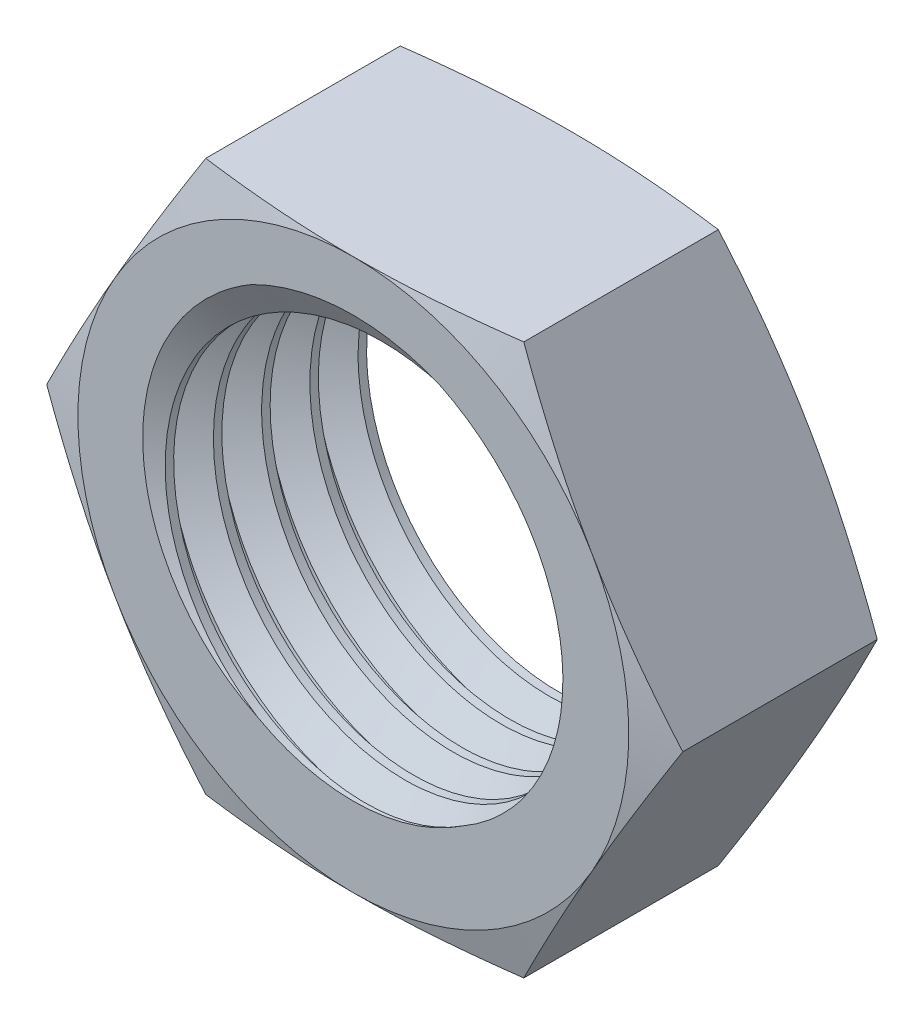
from build123d import *

# Parameters (mm, degrees)
BODY_DEPTH           = 8.2
SZKIC2_R             = 7.4
HOLE_DEPTH           = 8.2
SZKIC4_OUTSIDE_W     = 37.036
SZKIC4_OUTSIDE_H     = 33.82
SZKIC4_OUTSIDE_R     = 10.392304845
CHAMFERING_TOP_DEPTH = 0.6
CHAMFERING_TOP_DRAFT = -75
SZKIC3_OUTSIDE_W     = 37.036
SZKIC3_OUTSIDE_H     = 33.82
SZKIC3_OUTSIDE_R     = 10.392304845
CHAMFERING_BOT_DEPTH = 0.6
CHAMFERING_BOT_DRAFT = 75
THREAD_PITCH         = 1.82


with BuildPart() as part:
    # Szkic1 → body (new body)
    with BuildSketch(Plane.XY):
        Polygon((6, 10.392304845), (-6, 10.392304845), (-12, 0), (-6, -10.392304845), (6, -10.392304845), (12, 0), align=None)
    extrude(amount=BODY_DEPTH)

    # Szkic2 → hole (cut)
    with BuildSketch(Plane.XY):
        Circle(SZKIC2_R)
    extrude(amount=HOLE_DEPTH, mode=Mode.SUBTRACT)


with BuildPart() as chamfering_top_tool:
    # Szkic4 outside → chamfering-top (with draft: the straight prism first)
    with BuildSketch(Plane.XY.offset(8.2)):
        Rectangle(SZKIC4_OUTSIDE_W, SZKIC4_OUTSIDE_H)
        Circle(SZKIC4_OUTSIDE_R, mode=Mode.SUBTRACT)
    extrude(amount=-CHAMFERING_TOP_DEPTH)
    # chamfering-top: the draft: its side faces are tilted about the plane it starts from
    chamfering_top_sides = [chamfering_top_tool.faces().sort_by_distance(p)[0] for p in [
        (0, -16.91, 7.9),
        (18.518, 0, 7.9),
        (0, 16.91, 7.9),
        (-18.518, 0, 7.9),
        (-10.392304845, 0, 7.9),
    ]]
    draft(chamfering_top_sides, Plane.XY.offset(8.2), CHAMFERING_TOP_DRAFT)


with BuildPart() as part_1:
    add(part.part)

    # chamfering-top: cut by chamfering_top_tool
    add(chamfering_top_tool.part, mode=Mode.SUBTRACT)


with BuildPart() as chamfering_bot_tool:
    # Szkic3 outside → chamfering-bot (with draft: the straight prism first)
    with BuildSketch(Plane.XY):
        Rectangle(SZKIC3_OUTSIDE_W, SZKIC3_OUTSIDE_H)
        Circle(SZKIC3_OUTSIDE_R, mode=Mode.SUBTRACT)
    extrude(amount=CHAMFERING_BOT_DEPTH)
    # chamfering-bot: the draft: its side faces are tilted about the plane it starts from
    chamfering_bot_sides = [chamfering_bot_tool.faces().sort_by_distance(p)[0] for p in [
        (0, -16.91, 0.3),
        (18.518, 0, 0.3),
        (0, 16.91, 0.3),
        (-18.518, 0, 0.3),
        (-10.392304845, 0, 0.3),
    ]]
    draft(chamfering_bot_sides, Plane.XY, CHAMFERING_BOT_DRAFT)


with BuildPart() as part_2:
    add(part_1.part)

    # chamfering-bot: cut by chamfering_bot_tool
    add(chamfering_bot_tool.part, mode=Mode.SUBTRACT)

    # thread: the profile of Profil gwintu1 profile screwed along a right-hand helix of 6.593407 turns, 10 arcs to a turn; built about Z, then put on its axis
    thread_z = Axis((0, 0, 0), (0, 0, 1))
    thread_corners = [(7.3997, 2e-09, -0.000173205), (8.48253175, 2e-09, 0.624999997), (8.48253175, 2e-09, 0.874999997), (7.3997, 2e-09, 1.5001732)]
    with BuildLine(mode=Mode.PRIVATE) as thread_profile:
        Line(thread_corners[0], thread_corners[1])
        Line(thread_corners[1], thread_corners[2])
        Line(thread_corners[2], thread_corners[3])
        Line(thread_corners[3], thread_corners[0])
    thread_cap = Face(thread_profile.wire())
    thread_turn_angles = [0, 18, 36, 54, 72, 90, 108, 126, 144, 162, 180, 198, 216, 234, 252, 270, 288, 306, 324, 342, 360]
    thread_turn_weights = [1, 0.9510565162951535, 1, 0.9510565162951535, 1, 0.9510565162951535, 1, 0.9510565162951535, 1, 0.9510565162951535, 1, 0.9510565162951535, 1, 0.9510565162951535, 1, 0.9510565162951535, 1, 0.9510565162951535, 1, 0.9510565162951535, 1]
    thread_turn_rails = [Edge.make_bspline([Vector(p[0], p[1], 0).rotate(thread_z, thread_turn_angles[k]) / thread_turn_weights[k] + Vector(0, 0, p[2] + THREAD_PITCH * thread_turn_angles[k] / 360) for k in range(21)], [0, 0, 0, 1, 1, 2, 2, 3, 3, 4, 4, 5, 5, 6, 6, 7, 7, 8, 8, 9, 9, 10, 10, 10], 2, thread_turn_weights) for p in thread_corners]
    thread_turn_sides = [Face.make_surface_from_curves(thread_turn_rails[p[0]], thread_turn_rails[p[1]]) for p in [(0, 1), (1, 2), (2, 3), (3, 0)]]
    thread_last_angles = [2160, 2178, 2196, 2214, 2232, 2250, 2268, 2286, 2304, 2322, 2340, 2356.813186813, 2373.626373626]
    thread_last_weights = [1, 0.9510565162951535, 1, 0.9510565162951535, 1, 0.9510565162951535, 1, 0.9510565162951535, 1, 0.9510565162951535, 1, 0.9572529505536158, 1]
    thread_last_rails = [Edge.make_bspline([Vector(p[0], p[1], 0).rotate(thread_z, thread_last_angles[k]) / thread_last_weights[k] + Vector(0, 0, p[2] + THREAD_PITCH * thread_last_angles[k] / 360) for k in range(13)], [0, 0, 0, 1, 1, 2, 2, 3, 3, 4, 4, 5, 5, 6, 6, 6], 2, thread_last_weights) for p in thread_corners]
    thread_last_sides = [Face.make_surface_from_curves(thread_last_rails[p[0]], thread_last_rails[p[1]]) for p in [(0, 1), (1, 2), (2, 3), (3, 0)]]
    thread = Plane(origin=(0, 0, -2), x_dir=(0.920504853, 0.390731128, 0), z_dir=(0, 0, 1)) * Solid(Shell([*[p.moved(Location((0, 0, THREAD_PITCH * i))) for i in range(6) for p in thread_turn_sides], *thread_last_sides, thread_cap, thread_cap.rotate(thread_z, 2373.626373626).moved(Location((0, 0, THREAD_PITCH * 2373.626373626 / 360)))]))
    add(thread, mode=Mode.SUBTRACT)


solid = part_2.part
